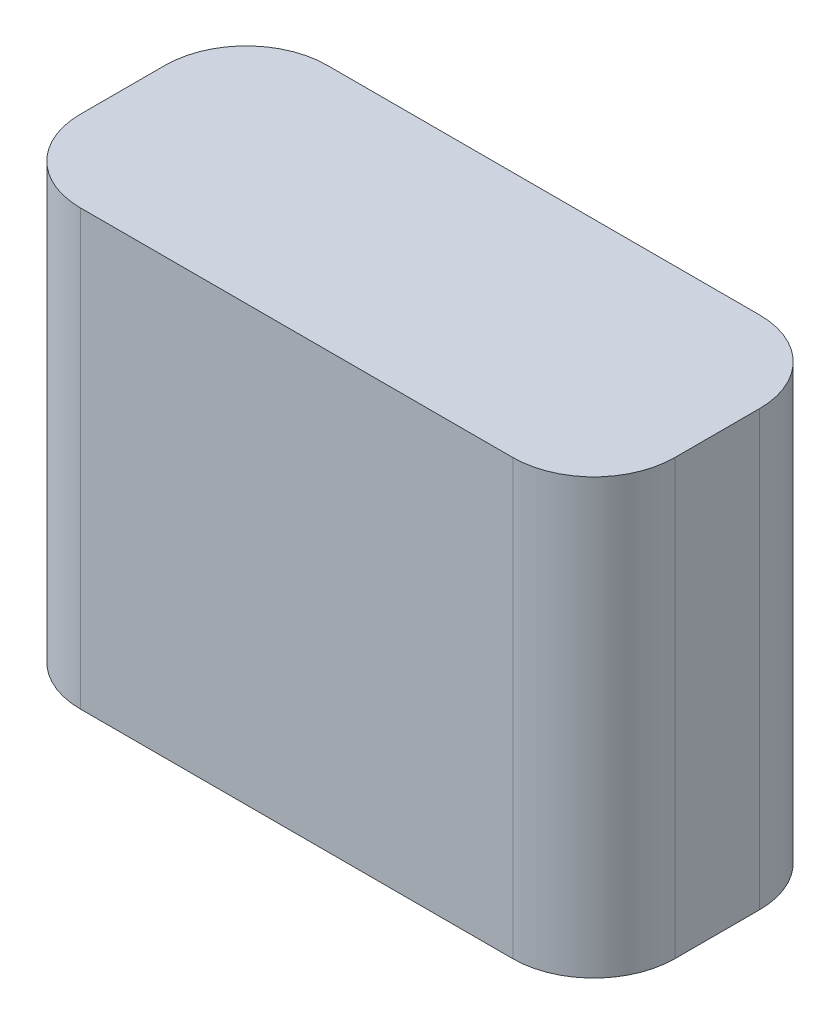
from build123d import *

# Parameters (mm, degrees)
SKETCH1_W           = 73.406
SKETCH1_H           = 30.48
BOSS_EXTRUDE1_DEPTH = 53.594
FILLET1_R           = 10


with BuildPart() as part:
    # Sketch1 → Boss-Extrude1 (new body)
    with BuildSketch(Plane(origin=(0, 0, 0), x_dir=(1, 0, 0), z_dir=(0, 1, 0))):
        Rectangle(SKETCH1_W, SKETCH1_H)
    extrude(amount=BOSS_EXTRUDE1_DEPTH)

    # Fillet1
    fillet1_edges = [part.edges().sort_by_distance(p)[0] for p in [
        (36.703, 26.797, 15.24),
        (36.703, 26.797, -15.24),
        (-36.703, 26.797, -15.24),
        (-36.703, 26.797, 15.24),
    ]]
    fillet(fillet1_edges, radius=FILLET1_R)


solid = part.part
